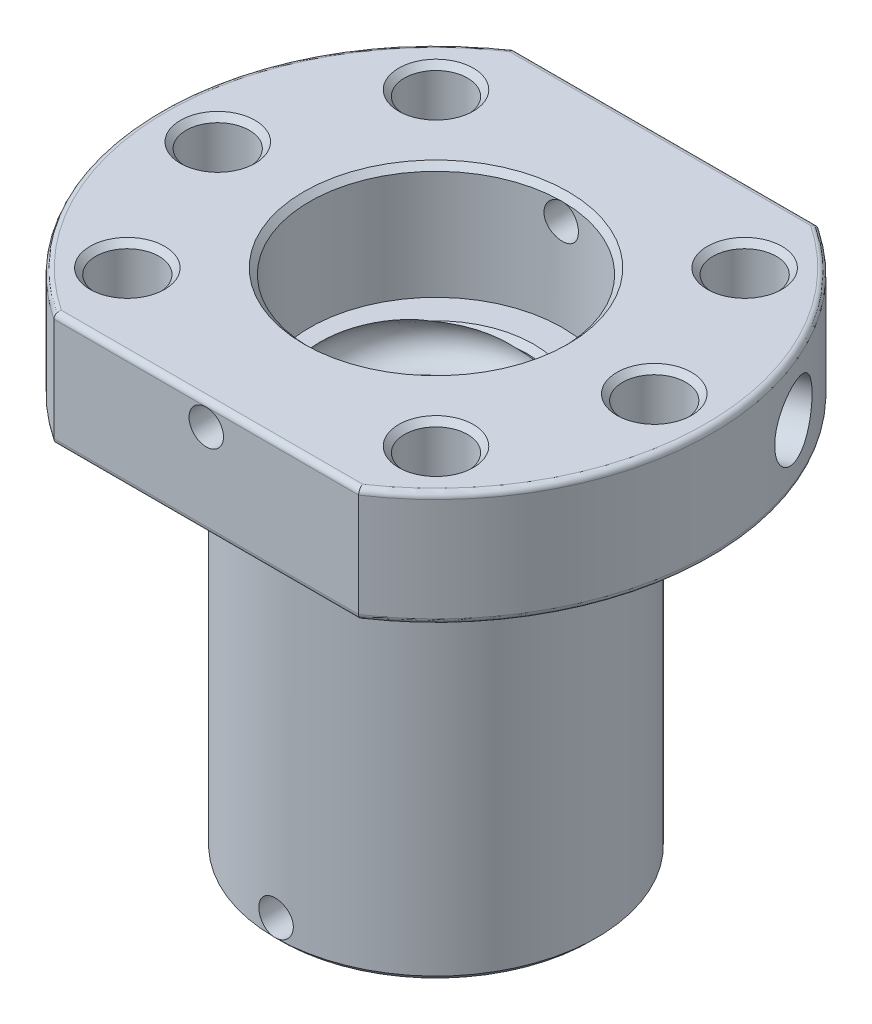
from build123d import *

# Parameters (mm, degrees)
CUT_EXTRUDE2_REACH      = 57.57
CUT_EXTRUDE3_REACH      = 55.963
SKETCH4_R               = 2.75
CHAMFER1_SIZE           = 0.5
CUT_EXTRUDE4_REACH      = 72.14
CUT_EXTRUDE4_END_RADIUS = 11
SKETCH5_R               = 2.5
SKETCH6_R               = 3
CUT_EXTRUDE5_DEPTH      = 10
FILLET1_R               = 0.5
SKETCH7_R               = 1.5
CUT_EXTRUDE6_DEPTH      = 65.124878267
SKETCH8_R               = 1.5
CUT_EXTRUDE7_DEPTH      = 28
CUT_SWEEP1_PITCH        = 5


with BuildPart() as part:
    # Sketch1 → Revolve1 (revolve)
    with BuildSketch(Plane(origin=(0, 0, 0), x_dir=(0, 0, -1), z_dir=(1, 0, 0))):
        Polygon((-11, 0), (-24, 0), (-24, -10), (-14, -10), (-14, -44), (-11, -44), (-11, -34), (-8, -34), (-8, -10), (-11, -10), align=None)
    revolve(axis=Axis((0, 0, 0), (0, -1, 0)))

    # Sketch2 → Cut-Extrude2 (cut, up to next)
    with BuildSketch(Plane(origin=(0, 0, 0), x_dir=(1, 0, 0), z_dir=(0, 1, 0)), mode=Mode.PRIVATE) as cut_extrude2_sk1:
        with BuildLine():
            Line((-13.266499161, 20), (13.266499161, 20))
            ThreePointArc((13.266499161, 20), (0, 24), (-13.266499161, 20))
        make_face()
    cut_extrude2_tool1 = extrude(cut_extrude2_sk1.sketch, amount=-CUT_EXTRUDE2_REACH, mode=Mode.PRIVATE) & part.part
    # Sketch2 → Cut-Extrude2 (cut, up to next)
    with BuildSketch(Plane(origin=(0, 0, 0), x_dir=(1, 0, 0), z_dir=(0, 1, 0)), mode=Mode.PRIVATE) as cut_extrude2_sk2:
        with BuildLine():
            Line((-13.266499161, -20), (13.266499161, -20))
            ThreePointArc((13.266499161, -20), (0, -24), (-13.266499161, -20))
        make_face()
    cut_extrude2_tool2 = extrude(cut_extrude2_sk2.sketch, amount=-CUT_EXTRUDE2_REACH, mode=Mode.PRIVATE) & part.part
    add(cut_extrude2_tool1.solids().sort_by_distance((0, 0, -21.612009))[0], mode=Mode.SUBTRACT)
    add(cut_extrude2_tool2.solids().sort_by_distance((0, 0, 21.612009))[0], mode=Mode.SUBTRACT)

    # Sketch4 → Cut-Extrude3 (cut, up to next)
    with BuildSketch(Plane(origin=(0, 0, 0), x_dir=(1, 0, 0), z_dir=(0, 1, 0)), mode=Mode.PRIVATE) as cut_extrude3_sk1:
        with Locations(Location((-19, 0, 0), (0, 0, 270))):
            Circle(SKETCH4_R)
    cut_extrude3_tool1 = extrude(cut_extrude3_sk1.sketch, amount=-CUT_EXTRUDE3_REACH, mode=Mode.PRIVATE) & part.part
    # Sketch4 → Cut-Extrude3 (cut, up to next)
    with BuildSketch(Plane(origin=(0, 0, 0), x_dir=(1, 0, 0), z_dir=(0, 1, 0)), mode=Mode.PRIVATE) as cut_extrude3_sk2:
        with Locations(Location((-13.435028843, -13.435028843, 0), (0, 0, 270))):
            Circle(SKETCH4_R)
    cut_extrude3_tool2 = extrude(cut_extrude3_sk2.sketch, amount=-CUT_EXTRUDE3_REACH, mode=Mode.PRIVATE) & part.part
    # Sketch4 → Cut-Extrude3 (cut, up to next)
    with BuildSketch(Plane(origin=(0, 0, 0), x_dir=(1, 0, 0), z_dir=(0, 1, 0)), mode=Mode.PRIVATE) as cut_extrude3_sk3:
        with Locations(Location((-13.435028843, 13.435028843, 0), (0, 0, 90))):
            Circle(SKETCH4_R)
    cut_extrude3_tool3 = extrude(cut_extrude3_sk3.sketch, amount=-CUT_EXTRUDE3_REACH, mode=Mode.PRIVATE) & part.part
    # Sketch4 → Cut-Extrude3 (cut, up to next)
    with BuildSketch(Plane(origin=(0, 0, 0), x_dir=(1, 0, 0), z_dir=(0, 1, 0)), mode=Mode.PRIVATE) as cut_extrude3_sk4:
        with Locations(Location((13.435028843, -13.435028843, 0), (0, 0, 90))):
            Circle(SKETCH4_R)
    cut_extrude3_tool4 = extrude(cut_extrude3_sk4.sketch, amount=-CUT_EXTRUDE3_REACH, mode=Mode.PRIVATE) & part.part
    # Sketch4 → Cut-Extrude3 (cut, up to next)
    with BuildSketch(Plane(origin=(0, 0, 0), x_dir=(1, 0, 0), z_dir=(0, 1, 0)), mode=Mode.PRIVATE) as cut_extrude3_sk5:
        with Locations(Location((19, 0, 0), (0, 0, 90))):
            Circle(SKETCH4_R)
    cut_extrude3_tool5 = extrude(cut_extrude3_sk5.sketch, amount=-CUT_EXTRUDE3_REACH, mode=Mode.PRIVATE) & part.part
    # Sketch4 → Cut-Extrude3 (cut, up to next)
    with BuildSketch(Plane(origin=(0, 0, 0), x_dir=(1, 0, 0), z_dir=(0, 1, 0)), mode=Mode.PRIVATE) as cut_extrude3_sk6:
        with Locations(Location((13.435028843, 13.435028843, 0), (0, 0, 270))):
            Circle(SKETCH4_R)
    cut_extrude3_tool6 = extrude(cut_extrude3_sk6.sketch, amount=-CUT_EXTRUDE3_REACH, mode=Mode.PRIVATE) & part.part
    add(cut_extrude3_tool1.solids().sort_by_distance((-19, 0, 0))[0], mode=Mode.SUBTRACT)
    add(cut_extrude3_tool2.solids().sort_by_distance((-13.435029, 0, 13.435029))[0], mode=Mode.SUBTRACT)
    add(cut_extrude3_tool3.solids().sort_by_distance((-13.435029, 0, -13.435029))[0], mode=Mode.SUBTRACT)
    add(cut_extrude3_tool4.solids().sort_by_distance((13.435029, 0, 13.435029))[0], mode=Mode.SUBTRACT)
    add(cut_extrude3_tool5.solids().sort_by_distance((19, 0, 0))[0], mode=Mode.SUBTRACT)
    add(cut_extrude3_tool6.solids().sort_by_distance((13.435029, 0, -13.435029))[0], mode=Mode.SUBTRACT)

    # Chamfer1
    chamfer1_edges = [part.edges().sort_by_distance(p)[0] for p in [
        (0, -44, -14),
        (-19, -10, -2.75),
        (-19, 0, -2.75),
        (-13.435028843, -10, 10.685028843),
        (-13.435028843, 0, 10.685028843),
        (-13.435028843, -10, -10.685028843),
        (-13.435028843, 0, -10.685028843),
        (13.435028843, -10, 16.185028843),
        (13.435028843, 0, 16.185028843),
        (19, -10, 2.75),
        (19, 0, 2.75),
        (13.435028843, -10, -16.185028843),
        (13.435028843, 0, -16.185028843),
        (0, 0, -11),
        (0, -10, -8),
        (0, -34, -8),
        (0, -44, -11),
    ]]
    chamfer(chamfer1_edges, length=CHAMFER1_SIZE)

    # Cut-Extrude4: up to this cylinder (the profile starts outside it)
    cut_extrude4_end = Plane(origin=(0, -5.000195, 0), z_dir=(0, 1, 0)) * Cylinder(CUT_EXTRUDE4_END_RADIUS, 167.28, mode=Mode.PRIVATE)
    # Sketch5 → Cut-Extrude4 (cut, up to the surface)
    with BuildSketch(Plane(origin=(22.17310878, 0, -9.184402377), x_dir=(-0.38268343236508734, 0, -0.9238795325112877), z_dir=(0.9238795325112877, 0, -0.38268343236508734)), mode=Mode.PRIVATE) as cut_extrude4_sk1:
        with Locations((0, -5.000195071)):
            Circle(SKETCH5_R)
    cut_extrude4_tool1 = extrude(cut_extrude4_sk1.sketch, amount=-CUT_EXTRUDE4_REACH, mode=Mode.PRIVATE) - cut_extrude4_end
    add(cut_extrude4_tool1.solids().sort_by_distance((22.173109, -5.000195, -9.184402))[0], mode=Mode.SUBTRACT)

    # Sketch6 → Cut-Extrude5 (cut)
    with BuildSketch(Plane(origin=(22.17310878, 0, -9.184402377), x_dir=(-0.38268343236508734, 0, -0.9238795325112877), z_dir=(0.9238795325112877, 0, -0.38268343236508734))):
        with Locations((0, -5.000195071)):
            Circle(SKETCH6_R)
    extrude(amount=-CUT_EXTRUDE5_DEPTH, mode=Mode.SUBTRACT)

    # Fillet1
    fillet1_edges = [part.edges().sort_by_distance(p)[0] for p in [
        (0, -10, -14),
        (24, -10, 0),
        (0, -10, 20),
        (0, 0, 20),
        (-24, 0, 0),
        (-24, -10, 0),
        (0, -10, -20),
        (0, 0, -20),
        (24, 0, 0),
    ]]
    fillet(fillet1_edges, radius=FILLET1_R)

    # Sketch7 → Cut-Extrude6 (cut, through all)
    with BuildSketch(Plane.XY.offset(20)):
        with Locations(Location((0, -2, 0), (0, 0, 90))):
            Circle(SKETCH7_R)
    extrude(amount=-CUT_EXTRUDE6_DEPTH, mode=Mode.SUBTRACT)

    # Sketch8 → Cut-Extrude7 (cut)
    with BuildSketch(Plane.XY.offset(14)):
        with Locations(Location((0, -42, 0), (0, 0, 270))):
            Circle(SKETCH8_R)
    extrude(amount=-CUT_EXTRUDE7_DEPTH, mode=Mode.SUBTRACT)

    # Cut-Sweep1: the profile of Sketch10 screwed along a right-hand helix of 8.8 turns, 12 arcs to a turn; built about Z, then put on its axis
    cut_sweep1_z = Axis((0, 0, 0), (0, 0, 1))
    cut_sweep1_corners = [(6.1, 0, 0), (8, 0, -1.9), (9.9, 0, 0), (8, 0, 1.9)]
    with BuildLine(mode=Mode.PRIVATE) as cut_sweep1_profile:
        ThreePointArc((6.1, 0, 0), (6.656497116, 0, -1.343502884), (8, 0, -1.9))
        ThreePointArc((8, 0, -1.9), (9.343502884, 0, -1.343502884), (9.9, 0, 0))
        ThreePointArc((9.9, 0, 0), (9.343502884, 0, 1.343502884), (8, 0, 1.9))
        ThreePointArc((8, 0, 1.9), (6.656497116, 0, 1.343502884), (6.1, 0, 0))
    cut_sweep1_cap = Face(cut_sweep1_profile.wire())
    cut_sweep1_arcs = [((6.1, 0, 0), (6.1, 0, -1.9), (8, 0, -1.9), (1, 0.7071067811865476, 1)), ((8, 0, -1.9), (9.9, 0, -1.9), (9.9, 0, 0), (1, 0.7071067811865476, 1)), ((9.9, 0, 0), (9.9, 0, 1.9), (8, 0, 1.9), (1, 0.7071067811865476, 1)), ((8, 0, 1.9), (6.1, 0, 1.9), (6.1, 0, 0), (1, 0.7071067811865476, 1))]  # start, shoulder, end, weights
    cut_sweep1_turn_angles = [0, 15, 30, 45, 60, 75, 90, 105, 120, 135, 150, 165, 180, 195, 210, 225, 240, 255, 270, 285, 300, 315, 330, 345, 360]
    cut_sweep1_turn_weights = [1, 0.9659258262890683, 1, 0.9659258262890683, 1, 0.9659258262890683, 1, 0.9659258262890683, 1, 0.9659258262890683, 1, 0.9659258262890683, 1, 0.9659258262890683, 1, 0.9659258262890683, 1, 0.9659258262890683, 1, 0.9659258262890683, 1, 0.9659258262890683, 1, 0.9659258262890683, 1]
    cut_sweep1_turn_sides = [Face.make_bezier_surface([[Vector(p[j][0], p[j][1], 0).rotate(cut_sweep1_z, cut_sweep1_turn_angles[2 * i + k]) / cut_sweep1_turn_weights[2 * i + k] + Vector(0, 0, p[j][2] + CUT_SWEEP1_PITCH * cut_sweep1_turn_angles[2 * i + k] / 360) for k in range(3)] for j in range(3)], [[p[3][j] * cut_sweep1_turn_weights[2 * i + k] for k in range(3)] for j in range(3)]) for p in cut_sweep1_arcs for i in range(12)]
    cut_sweep1_last_angles = [2880, 2895, 2910, 2925, 2940, 2955, 2970, 2985, 3000, 3015, 3030, 3045, 3060, 3075, 3090, 3105, 3120, 3135, 3150, 3159, 3168]
    cut_sweep1_last_weights = [1, 0.9659258262890683, 1, 0.9659258262890683, 1, 0.9659258262890683, 1, 0.9659258262890683, 1, 0.9659258262890683, 1, 0.9659258262890683, 1, 0.9659258262890683, 1, 0.9659258262890683, 1, 0.9659258262890683, 1, 0.9876883405951141, 1]
    cut_sweep1_last_sides = [Face.make_bezier_surface([[Vector(p[j][0], p[j][1], 0).rotate(cut_sweep1_z, cut_sweep1_last_angles[2 * i + k]) / cut_sweep1_last_weights[2 * i + k] + Vector(0, 0, p[j][2] + CUT_SWEEP1_PITCH * cut_sweep1_last_angles[2 * i + k] / 360) for k in range(3)] for j in range(3)], [[p[3][j] * cut_sweep1_last_weights[2 * i + k] for k in range(3)] for j in range(3)]) for p in cut_sweep1_arcs for i in range(10)]
    cut_sweep1 = Plane(origin=(0, 0, 0), x_dir=(0, 0, 1), z_dir=(0, -1, 0)) * Solid(Shell([*[p.moved(Location((0, 0, CUT_SWEEP1_PITCH * i))) for i in range(8) for p in cut_sweep1_turn_sides], *cut_sweep1_last_sides, cut_sweep1_cap, cut_sweep1_cap.rotate(cut_sweep1_z, 3168).moved(Location((0, 0, CUT_SWEEP1_PITCH * 3168 / 360)))]))
    add(cut_sweep1, mode=Mode.SUBTRACT)


solid = part.part
